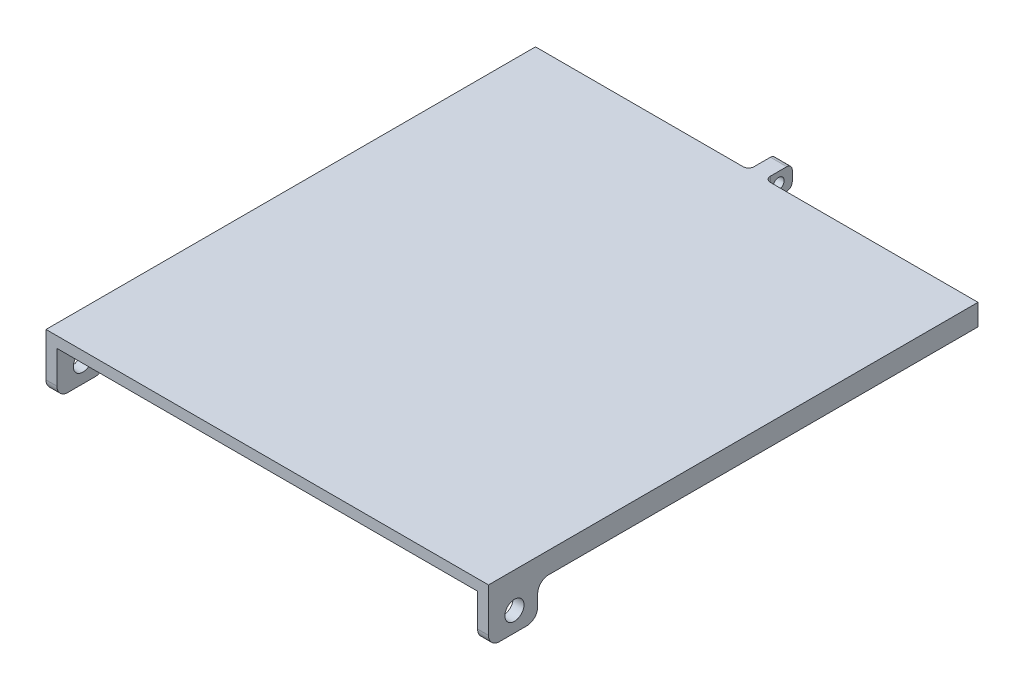
from build123d import *

# Parameters (mm, degrees)
BOSS_EXTRUDE2_DEPTH      = 8
SKETCH2_W                = 81
SKETCH2_H                = 89.6
BOSS_EXTRUDE3_DEPTH      = 2
SKETCH3_R                = 1.75
CUT_EXTRUDE1_DEPTH       = 125.5538661
CUT_EXTRUDE2_DEPTH       = 124.262587838
CUT_EXTRUDE2_DEPTH_BACK  = 124.262587838
SKETCH4_W                = 80.6
SKETCH4_H                = 6.1
SKETCH5_W                = 68.8
SKETCH5_H                = 1.2
BOSS_EXTRUDE4_DEPTH      = 2
FILLET2_R                = 2
BOSS_EXTRUDE5_DEPTH      = 1.5
BOSS_EXTRUDE5_DEPTH_BACK = 1.5
SKETCH7_R                = 1
FILLET5_R                = 1


with BuildPart() as part:
    # Sketch1 → Boss-Extrude2 (new body)
    with BuildSketch(Plane(origin=(0, 0, 0), x_dir=(1, 0, 0), z_dir=(0, 1, 0))):
        Polygon((-46.14154214, 4.488604838), (-46.14154214, 13.488604838), (-46.14154214, 92.088604838), (30.85845786, 92.088604838), (30.85845786, 13.488604838), (30.85845786, 4.488604838), (32.85845786, 4.488604838), (32.85845786, 94.088604838), (-48.14154214, 94.088604838), (-48.14154214, 4.488604838), align=None)
    extrude(amount=BOSS_EXTRUDE2_DEPTH)

    # Sketch2 → Boss-Extrude3 (add)
    with BuildSketch(Plane(origin=(0, 8, 0), x_dir=(1, 0, 0), z_dir=(0, 1, 0))):
        with Locations((-7.64154214, 49.288604838)):
            Rectangle(SKETCH2_W, SKETCH2_H)
    extrude(amount=BOSS_EXTRUDE3_DEPTH)

    # Sketch3 → Cut-Extrude1 (cut, through all)
    with BuildSketch(Plane(origin=(32.85845786, 0, 0), x_dir=(0, 0, -1), z_dir=(1, 0, 0))):
        with Locations((9.238604838, 3.6)):
            Circle(SKETCH3_R)
    extrude(amount=-CUT_EXTRUDE1_DEPTH, mode=Mode.SUBTRACT)

    # Sketch4 → Cut-Extrude2 (cut, two sides: drawn at the far end of the back side and taken through both)
    with BuildSketch(Plane.ZY.offset(-30.85845786).offset(-CUT_EXTRUDE2_DEPTH_BACK)):
        with Locations((-53.788604838, 3.05)):
            Rectangle(SKETCH4_W, SKETCH4_H)
    extrude(amount=CUT_EXTRUDE2_DEPTH + CUT_EXTRUDE2_DEPTH_BACK, mode=Mode.SUBTRACT)

    # Sketch5 → Boss-Extrude4 (add)
    with BuildSketch(Plane.XZ.offset(-8)):
        with Locations((-7.64154214, -12.405302831)):
            Rectangle(SKETCH5_W, SKETCH5_H)
    extrude(amount=BOSS_EXTRUDE4_DEPTH)

    # Fillet2
    fillet2_edges = [part.edges().sort_by_distance(p)[0] for p in [
        (-7.64154214, 8, -11.805302831),
        (-47.14154214, 0, -4.488604838),
        (-47.14154214, 0, -13.488604838),
        (-47.14154214, 6.1, -13.488604838),
        (31.85845786, 6.1, -13.488604838),
        (31.85845786, 0, -4.488604838),
        (31.85845786, 0, -13.488604838),
    ]]
    fillet(fillet2_edges, radius=FILLET2_R - 0.0001)  # a hair under: the kernel refuses the full size

    # Sketch7 → Boss-Extrude5 (add, two sides: drawn at the far end of the back side and taken through both)
    with BuildSketch(Plane.ZY.offset(7.64154214).offset(-BOSS_EXTRUDE5_DEPTH_BACK)):
        with BuildLine():
            Line((-94.088604838, 10), (-98.088604838, 10))
            ThreePointArc((-98.088604838, 10), (-98.79571162, 9.707106781), (-99.088604838, 9))
            Line((-99.088604838, 9), (-99.088604838, 7.1))
            ThreePointArc((-99.088604838, 7.1), (-98.79571162, 6.392893219), (-98.088604838, 6.1))
            Line((-98.088604838, 6.1), (-94.088604838, 6.1))
            Line((-94.088604838, 6.1), (-94.088604838, 10))
        make_face()
        with Locations((-96.588604838, 8.05)):
            Circle(SKETCH7_R, mode=Mode.SUBTRACT)
    extrude(amount=BOSS_EXTRUDE5_DEPTH + BOSS_EXTRUDE5_DEPTH_BACK)

    # Fillet5
    fillet5_edges = [part.edges().sort_by_distance(p)[0] for p in [
        (-6.14154214, 8.05, -94.088604838),
        (-9.14154214, 8.05, -94.088604838),
    ]]
    fillet(fillet5_edges, radius=FILLET5_R)


solid = part.part
